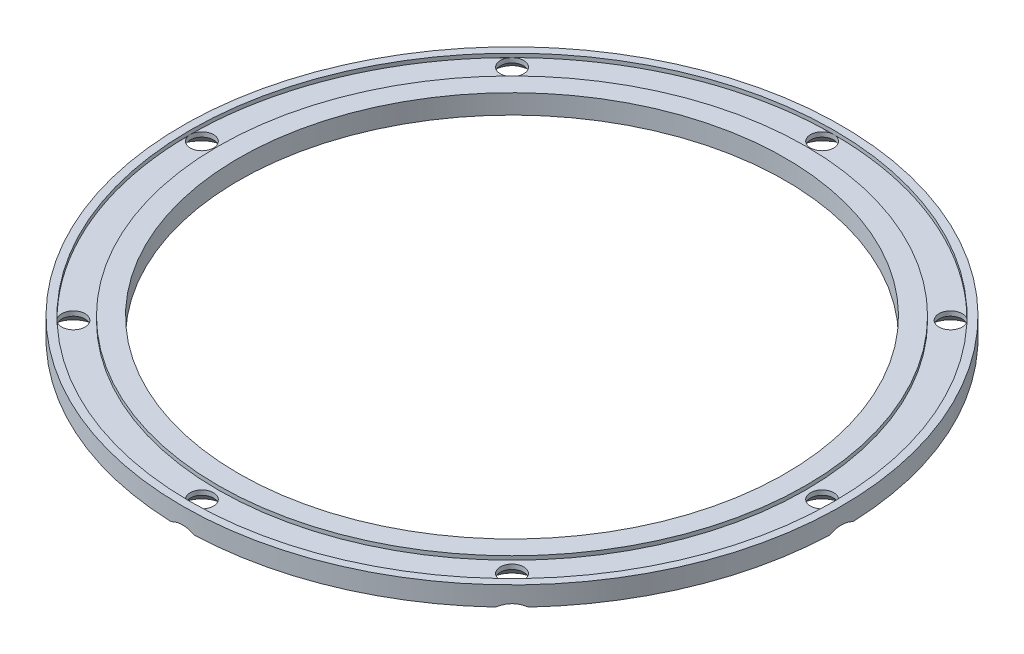
from build123d import *

# Parameters (mm, degrees)
SKETCH_1_R          = 42.5
SKETCH_1_R_2        = 35.25
EXTRUDE_1_DEPTH     = 2.5
SKETCH_2_R          = 1.5
CUT_EXTRUDE_1_DEPTH = 61.156047078
SKETCH_3_R          = 41.5
SKETCH_3_R_2        = 37.9
CUT_EXTRUDE_2_DEPTH = 0.5


with BuildPart() as part:
    # 草图1 → 凸台-拉伸1 (new body)
    with BuildSketch(Plane(origin=(0, 0, 0), x_dir=(1, 0, 0), z_dir=(0, 1, 0))):
        with Locations(Location((0, 0, 0), (0, 0, 270))):
            Circle(SKETCH_1_R)
        with Locations(Location((0, 0, 0), (0, 0, 270))):
            Circle(SKETCH_1_R_2, mode=Mode.SUBTRACT)
    extrude(amount=EXTRUDE_1_DEPTH)

    # 草图2 → 切除-拉伸1 (cut, through all)
    with BuildSketch(Plane.XZ):
        with Locations(Location((0, 40, 0), (0, 0, 270))):
            Circle(SKETCH_2_R)
        with Locations(Location((28.284271247, 28.284271247, 0), (0, 0, 270))):
            Circle(SKETCH_2_R)
        with Locations(Location((40, 0, 0), (0, 0, 270))):
            Circle(SKETCH_2_R)
        with Locations(Location((28.284271247, -28.284271247, 0), (0, 0, 270))):
            Circle(SKETCH_2_R)
        with Locations(Location((0, -40, 0), (0, 0, 270))):
            Circle(SKETCH_2_R)
        with Locations(Location((-28.284271247, -28.284271247, 0), (0, 0, 270))):
            Circle(SKETCH_2_R)
        with Locations(Location((-40, 0, 0), (0, 0, 270))):
            Circle(SKETCH_2_R)
        with Locations(Location((-28.284271247, 28.284271247, 0), (0, 0, 270))):
            Circle(SKETCH_2_R)
    extrude(amount=-CUT_EXTRUDE_1_DEPTH, mode=Mode.SUBTRACT)

    # 草图3 → 切除-拉伸2 (cut)
    with BuildSketch(Plane(origin=(0, 2.5, 0), x_dir=(1, 0, 0), z_dir=(0, 1, 0))):
        with Locations(Location((0, 0, 0), (0, 0, 270))):
            Circle(SKETCH_3_R)
        with Locations(Location((0, 0, 0), (0, 0, 270))):
            Circle(SKETCH_3_R_2, mode=Mode.SUBTRACT)
    extrude(amount=-CUT_EXTRUDE_2_DEPTH, mode=Mode.SUBTRACT)

    # 打孔尺寸(%根据十字)槽沉头木螺钉的类型1: read off the stored shape, not the designer's step
    # 打孔尺寸(%根据十字)槽沉头木螺钉的类型1: loft between two sections, ruled curve by curve
    hole_wizard_1_from = [
        Edge.make_three_point_arc((-40, 1.4, -1.5), (-38.5, 1.4, 0), (-40, 1.4, 1.5)),
        Edge.make_three_point_arc((-40, 1.4, 1.5), (-41.5, 1.4, 0), (-40, 1.4, -1.5)),
    ]
    hole_wizard_1_to = [
        Edge.make_three_point_arc((-40, -4.3e-08, -2.900000043), (-37.099999957, -4.3e-08, 0), (-40, -4.3e-08, 2.900000043)),
        Edge.make_three_point_arc((-40, -4.3e-08, 2.900000043), (-42.900000043, -4.3e-08, 0), (-40, -4.3e-08, -2.900000043)),
    ]
    hole_wizard_1 = Solid(Shell([*[Face.make_surface_from_curves(hole_wizard_1_from[k], hole_wizard_1_to[k]) for k in range(2)], Face(Wire(hole_wizard_1_from)), Face(Wire(hole_wizard_1_to))]))
    add(hole_wizard_1, mode=Mode.SUBTRACT)

    # Hole Wizard 1 2: loft between two sections, ruled curve by curve
    hole_wizard_1_2_from = [
        Edge.make_three_point_arc((-28.284271247, 1.4, -29.784271247), (-26.784271247, 1.4, -28.284271247), (-28.284271247, 1.4, -26.784271247)),
        Edge.make_three_point_arc((-28.284271247, 1.4, -26.784271247), (-29.784271247, 1.4, -28.284271247), (-28.284271247, 1.4, -29.784271247)),
    ]
    hole_wizard_1_2_to = [
        Edge.make_three_point_arc((-28.284271247, -4.3e-08, -31.18427129), (-25.384271205, -4.3e-08, -28.284271247), (-28.284271247, -4.3e-08, -25.384271205)),
        Edge.make_three_point_arc((-28.284271247, -4.3e-08, -25.384271205), (-31.18427129, -4.3e-08, -28.284271247), (-28.284271247, -4.3e-08, -31.18427129)),
    ]
    hole_wizard_1_2 = Solid(Shell([*[Face.make_surface_from_curves(hole_wizard_1_2_from[k], hole_wizard_1_2_to[k]) for k in range(2)], Face(Wire(hole_wizard_1_2_from)), Face(Wire(hole_wizard_1_2_to))]))
    add(hole_wizard_1_2, mode=Mode.SUBTRACT)

    # Hole Wizard 1 3: loft between two sections, ruled curve by curve
    hole_wizard_1_3_from = [
        Edge.make_three_point_arc((0, 1.4, -41.5), (1.5, 1.4, -40), (0, 1.4, -38.5)),
        Edge.make_three_point_arc((0, 1.4, -38.5), (-1.5, 1.4, -40), (0, 1.4, -41.5)),
    ]
    hole_wizard_1_3_to = [
        Edge.make_three_point_arc((0, -4.3e-08, -42.900000043), (2.900000043, -4.3e-08, -40), (0, -4.3e-08, -37.099999957)),
        Edge.make_three_point_arc((0, -4.3e-08, -37.099999957), (-2.900000043, -4.3e-08, -40), (0, -4.3e-08, -42.900000043)),
    ]
    hole_wizard_1_3 = Solid(Shell([*[Face.make_surface_from_curves(hole_wizard_1_3_from[k], hole_wizard_1_3_to[k]) for k in range(2)], Face(Wire(hole_wizard_1_3_from)), Face(Wire(hole_wizard_1_3_to))]))
    add(hole_wizard_1_3, mode=Mode.SUBTRACT)

    # Hole Wizard 1 4: loft between two sections, ruled curve by curve
    hole_wizard_1_4_from = [
        Edge.make_three_point_arc((28.284271247, 1.4, -29.784271247), (29.784271247, 1.4, -28.284271247), (28.284271247, 1.4, -26.784271247)),
        Edge.make_three_point_arc((28.284271247, 1.4, -26.784271247), (26.784271247, 1.4, -28.284271247), (28.284271247, 1.4, -29.784271247)),
    ]
    hole_wizard_1_4_to = [
        Edge.make_three_point_arc((28.284271247, -4.3e-08, -31.18427129), (31.18427129, -4.3e-08, -28.284271247), (28.284271247, -4.3e-08, -25.384271205)),
        Edge.make_three_point_arc((28.284271247, -4.3e-08, -25.384271205), (25.384271205, -4.3e-08, -28.284271247), (28.284271247, -4.3e-08, -31.18427129)),
    ]
    hole_wizard_1_4 = Solid(Shell([*[Face.make_surface_from_curves(hole_wizard_1_4_from[k], hole_wizard_1_4_to[k]) for k in range(2)], Face(Wire(hole_wizard_1_4_from)), Face(Wire(hole_wizard_1_4_to))]))
    add(hole_wizard_1_4, mode=Mode.SUBTRACT)

    # Hole Wizard 1 5: loft between two sections, ruled curve by curve
    hole_wizard_1_5_from = [
        Edge.make_three_point_arc((40, 1.4, -1.5), (41.5, 1.4, 0), (40, 1.4, 1.5)),
        Edge.make_three_point_arc((40, 1.4, 1.5), (38.5, 1.4, 0), (40, 1.4, -1.5)),
    ]
    hole_wizard_1_5_to = [
        Edge.make_three_point_arc((40, -4.3e-08, -2.900000043), (42.900000043, -4.3e-08, 0), (40, -4.3e-08, 2.900000043)),
        Edge.make_three_point_arc((40, -4.3e-08, 2.900000043), (37.099999957, -4.3e-08, 0), (40, -4.3e-08, -2.900000043)),
    ]
    hole_wizard_1_5 = Solid(Shell([*[Face.make_surface_from_curves(hole_wizard_1_5_from[k], hole_wizard_1_5_to[k]) for k in range(2)], Face(Wire(hole_wizard_1_5_from)), Face(Wire(hole_wizard_1_5_to))]))
    add(hole_wizard_1_5, mode=Mode.SUBTRACT)

    # Hole Wizard 1 6: loft between two sections, ruled curve by curve
    hole_wizard_1_6_from = [
        Edge.make_three_point_arc((28.284271247, 1.4, 26.784271247), (29.784271247, 1.4, 28.284271247), (28.284271247, 1.4, 29.784271247)),
        Edge.make_three_point_arc((28.284271247, 1.4, 29.784271247), (26.784271247, 1.4, 28.284271247), (28.284271247, 1.4, 26.784271247)),
    ]
    hole_wizard_1_6_to = [
        Edge.make_three_point_arc((28.284271247, -4.3e-08, 25.384271205), (31.18427129, -4.3e-08, 28.284271247), (28.284271247, -4.3e-08, 31.18427129)),
        Edge.make_three_point_arc((28.284271247, -4.3e-08, 31.18427129), (25.384271205, -4.3e-08, 28.284271247), (28.284271247, -4.3e-08, 25.384271205)),
    ]
    hole_wizard_1_6 = Solid(Shell([*[Face.make_surface_from_curves(hole_wizard_1_6_from[k], hole_wizard_1_6_to[k]) for k in range(2)], Face(Wire(hole_wizard_1_6_from)), Face(Wire(hole_wizard_1_6_to))]))
    add(hole_wizard_1_6, mode=Mode.SUBTRACT)

    # Hole Wizard 1 7: loft between two sections, ruled curve by curve
    hole_wizard_1_7_from = [
        Edge.make_three_point_arc((0, 1.4, 38.5), (1.5, 1.4, 40), (0, 1.4, 41.5)),
        Edge.make_three_point_arc((0, 1.4, 41.5), (-1.5, 1.4, 40), (0, 1.4, 38.5)),
    ]
    hole_wizard_1_7_to = [
        Edge.make_three_point_arc((0, -4.3e-08, 37.099999957), (2.900000043, -4.3e-08, 40), (0, -4.3e-08, 42.900000043)),
        Edge.make_three_point_arc((0, -4.3e-08, 42.900000043), (-2.900000043, -4.3e-08, 40), (0, -4.3e-08, 37.099999957)),
    ]
    hole_wizard_1_7 = Solid(Shell([*[Face.make_surface_from_curves(hole_wizard_1_7_from[k], hole_wizard_1_7_to[k]) for k in range(2)], Face(Wire(hole_wizard_1_7_from)), Face(Wire(hole_wizard_1_7_to))]))
    add(hole_wizard_1_7, mode=Mode.SUBTRACT)

    # Hole Wizard 1 8: loft between two sections, ruled curve by curve
    hole_wizard_1_8_from = [
        Edge.make_three_point_arc((-28.284271247, 1.4, 26.784271247), (-26.784271247, 1.4, 28.284271247), (-28.284271247, 1.4, 29.784271247)),
        Edge.make_three_point_arc((-28.284271247, 1.4, 29.784271247), (-29.784271247, 1.4, 28.284271247), (-28.284271247, 1.4, 26.784271247)),
    ]
    hole_wizard_1_8_to = [
        Edge.make_three_point_arc((-28.284271247, -4.3e-08, 25.384271205), (-25.384271205, -4.3e-08, 28.284271247), (-28.284271247, -4.3e-08, 31.18427129)),
        Edge.make_three_point_arc((-28.284271247, -4.3e-08, 31.18427129), (-31.18427129, -4.3e-08, 28.284271247), (-28.284271247, -4.3e-08, 25.384271205)),
    ]
    hole_wizard_1_8 = Solid(Shell([*[Face.make_surface_from_curves(hole_wizard_1_8_from[k], hole_wizard_1_8_to[k]) for k in range(2)], Face(Wire(hole_wizard_1_8_from)), Face(Wire(hole_wizard_1_8_to))]))
    add(hole_wizard_1_8, mode=Mode.SUBTRACT)


solid = part.part
